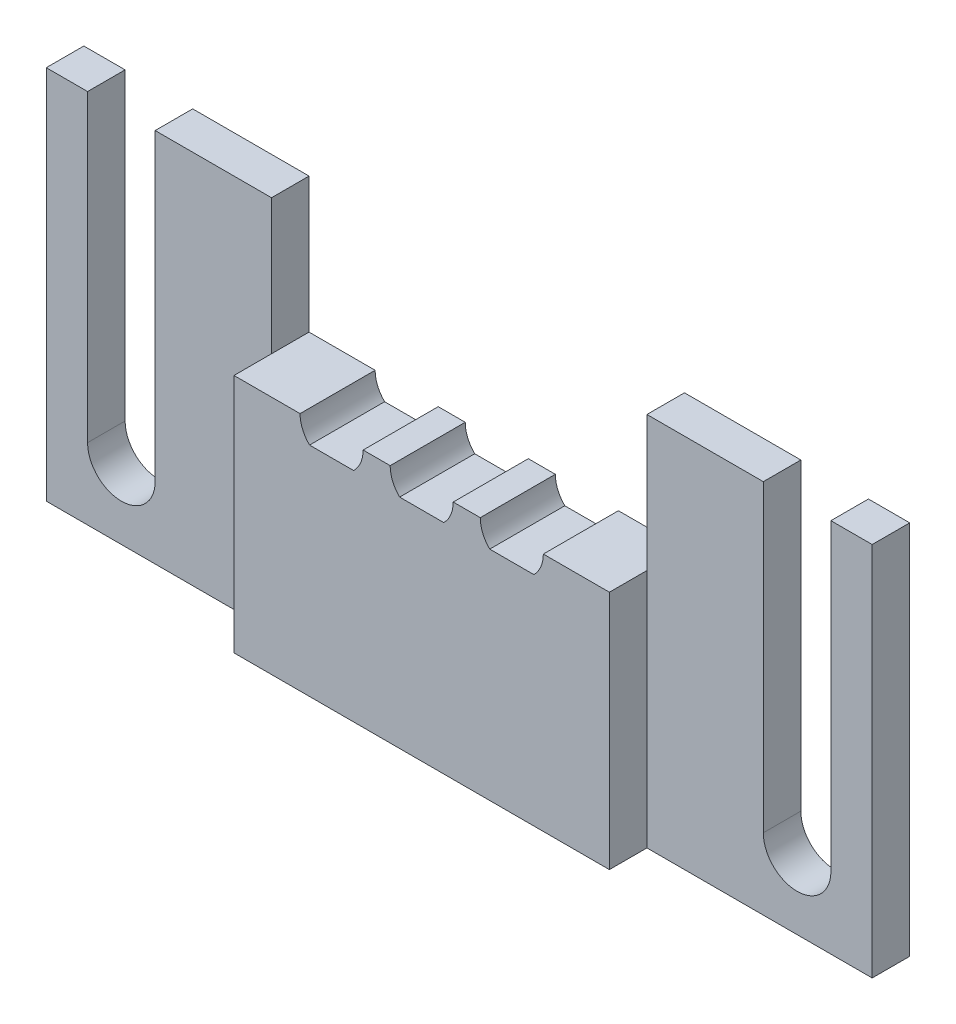
from build123d import *

# Parameters (mm, degrees)
SKICA1_W                 = 55
SKICA1_H                 = 25
P_IDAT_VYSUNUT_M1_DEPTH  = 5
ODEBRAT_VYSUNUT_M1_DEPTH = 10
SKICA3_W                 = 15
SKICA3_H                 = 25
ODEBRAT_VYSUNUT_M2_DEPTH = 2.5
M4_D_RA_S_V_L_4_DEPTH    = 2.5


# Read off the part's stored shape, not the designer's step: M4 díra s vůlí4
with BuildPart() as part:
    # Skica1 → Přidat vysunutím1 (new body)
    with BuildSketch(Plane.XY):
        Rectangle(SKICA1_W, SKICA1_H)
    extrude(amount=P_IDAT_VYSUNUT_M1_DEPTH)

    # Skica2 → Odebrat vysunutím1 (cut)
    with BuildSketch(Plane.XY.offset(5)):
        with BuildLine():
            Line((-12.5, 3.5), (-8.1, 3.5))
            ThreePointArc((-8.1, 3.5), (-7.936021317, 2.6864759), (-7.469693846, 2))
            Line((-7.469693846, 2), (-4.530306154, 2))
            ThreePointArc((-4.530306154, 2), (-4.063978683, 2.6864759), (-3.9, 3.5))
            Line((-3.9, 3.5), (-2.1, 3.5))
            ThreePointArc((-2.1, 3.5), (-1.936021317, 2.6864759), (-1.469693846, 2))
            Line((-1.469693846, 2), (1.469693846, 2))
            ThreePointArc((1.469693846, 2), (1.936021317, 2.6864759), (2.1, 3.5))
            Line((2.1, 3.5), (3.9, 3.5))
            ThreePointArc((3.9, 3.5), (4.063978683, 2.6864759), (4.530306154, 2))
            Line((4.530306154, 2), (7.469693846, 2))
            ThreePointArc((7.469693846, 2), (7.936021317, 2.6864759), (8.1, 3.5))
            Line((8.1, 3.5), (12.5, 3.5))
            Line((12.5, 3.5), (12.5, 12.5))
            Line((12.5, 12.5), (-12.5, 12.5))
            Line((-12.5, 12.5), (-12.5, 3.5))
        make_face()
    extrude(amount=-ODEBRAT_VYSUNUT_M1_DEPTH, mode=Mode.SUBTRACT)

    # Skica3 → Odebrat vysunutím2 (cut)
    with BuildSketch(Plane.XY.offset(5)):
        with Locations((-20, 0)):
            Rectangle(SKICA3_W, SKICA3_H)
        with Locations((20, 0)):
            Rectangle(SKICA3_W, SKICA3_H)
    extrude(amount=-ODEBRAT_VYSUNUT_M2_DEPTH, mode=Mode.SUBTRACT)

    # M4 díra s vůlí4 outline → M4 díra s vůlí4 (cut)
    with BuildSketch(Plane.XY):
        with BuildLine():
            Line((-20.25, 12.5), (-24.75, 12.5))
            Line((-24.75, 12.5), (-24.75, -7.75))
            ThreePointArc((-24.75, -7.75), (-22.5, -10), (-20.25, -7.75))
            Line((-20.25, -7.75), (-20.25, 12.5))
        make_face()
        with BuildLine():
            Line((24.75, 12.5), (20.25, 12.5))
            Line((20.25, 12.5), (20.25, -7.75))
            ThreePointArc((20.25, -7.75), (22.5, -10), (24.75, -7.75))
            Line((24.75, -7.75), (24.75, 12.5))
        make_face()
    extrude(amount=M4_D_RA_S_V_L_4_DEPTH, mode=Mode.SUBTRACT)


solid = part.part
